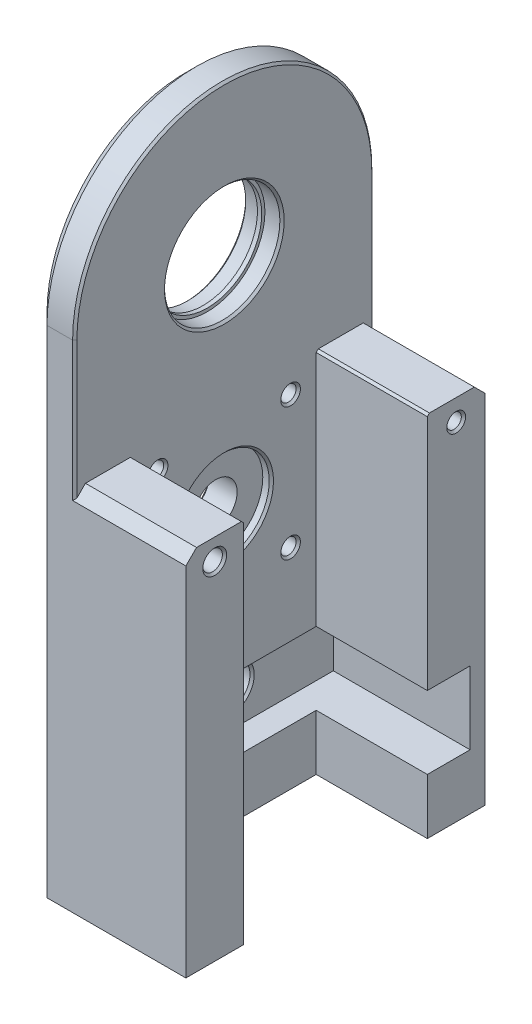
from build123d import *

# Parameters (mm, degrees)
SKETCH2_W                                           = 70
SKETCH2_H                                           = 86
BOSS_EXTRUDE1_DEPTH                                 = 35
SKETCH9_W                                           = 43
SKETCH9_H                                           = 43
SKETCH9_R                                           = 11
SKETCH9_R_2                                         = 5
SKETCH9_W_2                                         = 10
SKETCH9_H_2                                         = 17
CUT_EXTRUDE1_DEPTH                                  = 26
SKETCH2_5_R                                         = 12.75
BOSS_EXTRUDE2_DEPTH                                 = 9
SKETCH9_3_R                                         = 11
SKETCH9_3_R_2                                       = 5
CUT_EXTRUDE2_DEPTH                                  = 28
SKETCH9_4_R                                         = 5
CUT_EXTRUDE3_DEPTH                                  = 171.076453397
SKETCH20_R                                          = 13.5
CUT_EXTRUDE4_DEPTH                                  = 4
CBORE_FOR_M3_HEX_SOCKET_HEAD_CAP_SCREW1_D           = 3.6
CBORE_FOR_M3_HEX_SOCKET_HEAD_CAP_SCREW1_CBORE_D     = 6.5
CBORE_FOR_M3_HEX_SOCKET_HEAD_CAP_SCREW1_CBORE_DEPTH = 3.4
F_4_6_4_6_DIAMETER_HOLE1_D                          = 4.6
F_4_6_4_6_DIAMETER_HOLE1_DEPTH                      = 6
F_4_6_4_6_DIAMETER_HOLE1_TIP                        = 1.381979424
CBORE_FOR_M3_HEX_SOCKET_HEAD_CAP_SCREW2_D           = 3.4
CBORE_FOR_M3_HEX_SOCKET_HEAD_CAP_SCREW2_CBORE_D     = 6.5
CBORE_FOR_M3_HEX_SOCKET_HEAD_CAP_SCREW2_CBORE_DEPTH = 21.4
F_4_6_4_6_DIAMETER_HOLE2_D                          = 4.6
F_4_6_4_6_DIAMETER_HOLE2_DEPTH                      = 6
F_4_6_4_6_DIAMETER_HOLE2_TIP                        = 1.381979424
F_4_6_4_6_DIAMETER_HOLE3_D                          = 4.6
F_4_6_4_6_DIAMETER_HOLE3_DEPTH                      = 5
F_4_6_4_6_DIAMETER_HOLE3_TIP                        = 1.381979424
CUT_EXTRUDE5_DEPTH                                  = 6
CUT_EXTRUDE6_REACH                                  = 170.455
F_2_5MM_CHAMFER1_SIZE                               = 2.5
F_0_5MM_CHAMFER2_SIZE                               = 0.5


with BuildPart() as part:
    # Sketch2 → Boss-Extrude1 (new body)
    with BuildSketch(Plane(origin=(0, 0, 0), x_dir=(0, 0, -1), z_dir=(1, 0, 0))):
        with Locations((35, 43)):
            Rectangle(SKETCH2_W, SKETCH2_H)
    extrude(amount=BOSS_EXTRUDE1_DEPTH)

    # Sketch9 → Cut-Extrude1 (cut)
    # profile 1 of 5: a face of its own
    with BuildSketch(Plane(origin=(35, 0, 0), x_dir=(0, 0, -1), z_dir=(1, 0, 0))):
        with Locations((35, 64.5)):
            Rectangle(SKETCH9_W, SKETCH9_H)
        with Locations((35, 64.5)):
            Circle(SKETCH9_R, mode=Mode.SUBTRACT)
    # profile 2 of 5: a face of its own
    with BuildSketch(Plane(origin=(35, 0, 0), x_dir=(0, 0, -1), z_dir=(1, 0, 0))):
        with Locations((35, 64.5)):
            Circle(SKETCH9_R)
        with Locations((35, 64.5)):
            Circle(SKETCH9_R_2, mode=Mode.SUBTRACT)
    # profile 3 of 5: a face of its own
    with BuildSketch(Plane(origin=(35, 0, 0), x_dir=(0, 0, -1), z_dir=(1, 0, 0))):
        with Locations((35, 64.5)):
            Circle(SKETCH9_R_2)
    # profile 4 of 5: a face of its own
    with BuildSketch(Plane(origin=(35, 0, 0), x_dir=(0, 0, -1), z_dir=(1, 0, 0))):
        Polygon((56.5, 43), (13.5, 43), (13.5, 0), (56.5, 0), (56.5, 13), (56.5, 30), align=None)
    # profile 5 of 5: a face of its own
    with BuildSketch(Plane(origin=(35, 0, 0), x_dir=(0, 0, -1), z_dir=(1, 0, 0))):
        with Locations((61.5, 21.5)):
            Rectangle(SKETCH9_W_2, SKETCH9_H_2)
    extrude(amount=-CUT_EXTRUDE1_DEPTH, mode=Mode.SUBTRACT)

    # Sketch2<5> → Boss-Extrude2 (add)
    with BuildSketch(Plane(origin=(0, 0, 0), x_dir=(0, 0, -1), z_dir=(1, 0, 0))):
        with BuildLine():
            Line((0, 116), (0, 86))
            Line((0, 86), (70, 86))
            Line((70, 86), (70, 116))
            ThreePointArc((70, 116), (35, 151), (0, 116))
        make_face()
        with Locations((35, 116)):
            Circle(SKETCH2_5_R, mode=Mode.SUBTRACT)
    extrude(amount=BOSS_EXTRUDE2_DEPTH)

    # Sketch9<3> → Cut-Extrude2 (cut)
    # profile 1 of 2: a face of its own
    with BuildSketch(Plane(origin=(35, 0, 0), x_dir=(0, 0, -1), z_dir=(1, 0, 0))):
        with Locations((35, 64.5)):
            Circle(SKETCH9_3_R)
        with Locations((35, 64.5)):
            Circle(SKETCH9_3_R_2, mode=Mode.SUBTRACT)
    # profile 2 of 2: a face of its own
    with BuildSketch(Plane(origin=(35, 0, 0), x_dir=(0, 0, -1), z_dir=(1, 0, 0))):
        with Locations((35, 64.5)):
            Circle(SKETCH9_3_R_2)
    extrude(amount=-CUT_EXTRUDE2_DEPTH, mode=Mode.SUBTRACT)

    # Sketch9<4> → Cut-Extrude3 (cut, through all)
    with BuildSketch(Plane(origin=(35, 0, 0), x_dir=(0, 0, -1), z_dir=(1, 0, 0))):
        with Locations((35, 64.5)):
            Circle(SKETCH9_4_R)
    extrude(amount=-CUT_EXTRUDE3_DEPTH, mode=Mode.SUBTRACT)

    # Sketch20 → Cut-Extrude4 (cut)
    with BuildSketch(Plane(origin=(9, 0, 0), x_dir=(0, 0, -1), z_dir=(1, 0, 0))):
        with Locations((35, 116)):
            Circle(SKETCH20_R)
    cut_extrude4 = extrude(amount=-CUT_EXTRUDE4_DEPTH, mode=Mode.SUBTRACT)

    # Mirror1: Cut-Extrude4 across plane
    add(cut_extrude4.mirror(Plane(origin=(4.5, 0, 0), x_dir=(0, 0, 1), z_dir=(1, 0, 0))), mode=Mode.SUBTRACT)

    # CBORE for M3 Hex Socket Head Cap Screw1 (through all)
    with Locations(Plane.ZY):
        with Locations((-19.5, 49), (-35, 64.5), (-19.5, 80), (-50.5, 49), (-50.5, 80)):
            CounterBoreHole(CBORE_FOR_M3_HEX_SOCKET_HEAD_CAP_SCREW1_D / 2, CBORE_FOR_M3_HEX_SOCKET_HEAD_CAP_SCREW1_CBORE_D / 2, CBORE_FOR_M3_HEX_SOCKET_HEAD_CAP_SCREW1_CBORE_DEPTH)

    # Ø4.6 (4.6) Diameter Hole1
    with Locations(Plane(origin=(0, 0, 0), x_dir=(-1, 0, 0), z_dir=(0, -1, 0))):
        with Locations((-4.5, 35), (-35, 35), (-4.5, 63.5), (-4.5, 6.5)):
            Hole(F_4_6_4_6_DIAMETER_HOLE1_D / 2, depth=F_4_6_4_6_DIAMETER_HOLE1_DEPTH)
            with Locations((0, 0, -(F_4_6_4_6_DIAMETER_HOLE1_DEPTH + F_4_6_4_6_DIAMETER_HOLE1_TIP / 2))):  # 118° drill point
                Cone(0, F_4_6_4_6_DIAMETER_HOLE1_D / 2, F_4_6_4_6_DIAMETER_HOLE1_TIP, mode=Mode.SUBTRACT)

    # CBORE for M3 Hex Socket Head Cap Screw2 (through all)
    with Locations(Plane.ZY):
        with Locations((-63.25, 81)):
            CounterBoreHole(CBORE_FOR_M3_HEX_SOCKET_HEAD_CAP_SCREW2_D / 2, CBORE_FOR_M3_HEX_SOCKET_HEAD_CAP_SCREW2_CBORE_D / 2, CBORE_FOR_M3_HEX_SOCKET_HEAD_CAP_SCREW2_CBORE_DEPTH)

    # Ø4.6 (4.6) Diameter Hole2
    with Locations(Plane(origin=(35, 0, 0), x_dir=(0, 0, -1), z_dir=(1, 0, 0))):
        with Locations((6.75, 81)):
            Hole(F_4_6_4_6_DIAMETER_HOLE2_D / 2, depth=F_4_6_4_6_DIAMETER_HOLE2_DEPTH)
            with Locations((0, 0, -(F_4_6_4_6_DIAMETER_HOLE2_DEPTH + F_4_6_4_6_DIAMETER_HOLE2_TIP / 2))):  # 118° drill point
                Cone(0, F_4_6_4_6_DIAMETER_HOLE2_D / 2, F_4_6_4_6_DIAMETER_HOLE2_TIP, mode=Mode.SUBTRACT)

    # Ø4.6 (4.6) Diameter Hole3
    with Locations(Plane.ZY):
        with Locations((-60, 89.5), (-10, 89.5)):
            Hole(F_4_6_4_6_DIAMETER_HOLE3_D / 2, depth=F_4_6_4_6_DIAMETER_HOLE3_DEPTH)
            with Locations((0, 0, -(F_4_6_4_6_DIAMETER_HOLE3_DEPTH + F_4_6_4_6_DIAMETER_HOLE3_TIP / 2))):  # 118° drill point
                Cone(0, F_4_6_4_6_DIAMETER_HOLE3_D / 2, F_4_6_4_6_DIAMETER_HOLE3_TIP, mode=Mode.SUBTRACT)

    # Sketch23 → Cut-Extrude5 (cut)
    # profile 1 of 2: a face of its own
    with BuildSketch(Plane(origin=(9, 0, 0), x_dir=(0, 0, -1), z_dir=(1, 0, 0))):
        Polygon((56.5, 13), (66.5, 13), (66.5, 30), (56.5, 30), (22.5, 30), (22.5, 21.49999992), (22.5, 13), align=None)
        with BuildLine():
            ThreePointArc((27.5, 16.5), (23.964466122, 17.964466066), (22.5, 21.49999992))
            ThreePointArc((22.5, 21.49999992), (23.964466066, 25.035533878), (27.5, 26.5))
            Line((27.5, 26.5), (42.5, 26.5))
            ThreePointArc((42.5, 26.5), (47.5, 21.5), (42.5, 16.5))
            Line((42.5, 16.5), (27.5, 16.5))
        make_face(mode=Mode.SUBTRACT)
    # profile 2 of 2: a face of its own
    with BuildSketch(Plane(origin=(9, 0, 0), x_dir=(0, 0, -1), z_dir=(1, 0, 0))):
        with BuildLine():
            Line((27.5, 16.5), (42.5, 16.5))
            ThreePointArc((42.5, 16.5), (47.5, 21.5), (42.5, 26.5))
            Line((42.5, 26.5), (27.5, 26.5))
            ThreePointArc((27.5, 26.5), (22.5, 21.5), (27.5, 16.5))
        make_face()
    extrude(amount=-CUT_EXTRUDE5_DEPTH, mode=Mode.SUBTRACT)

    # Sketch23<3> → Cut-Extrude6 (cut, up to next)
    with BuildSketch(Plane(origin=(9, 0, 0), x_dir=(0, 0, -1), z_dir=(1, 0, 0)), mode=Mode.PRIVATE) as cut_extrude6_sk1:
        with BuildLine():
            Line((27.5, 16.5), (42.5, 16.5))
            ThreePointArc((42.5, 16.5), (47.5, 21.5), (42.5, 26.5))
            Line((42.5, 26.5), (27.5, 26.5))
            ThreePointArc((27.5, 26.5), (22.5, 21.5), (27.5, 16.5))
        make_face()
    cut_extrude6_tool1 = extrude(cut_extrude6_sk1.sketch, amount=-CUT_EXTRUDE6_REACH, mode=Mode.PRIVATE) & part.part
    add(cut_extrude6_tool1.solids().sort_by_distance((9, 21.5, -35))[0], mode=Mode.SUBTRACT)

    # 2,5mm Chamfer1
    f_2_5mm_chamfer1_edges = [part.edges().sort_by_distance(p)[0] for p in [
        (0, 151, -35),
        (0, 58, 0),
        (0, 58, -70),
        (22, 86, 0),
        (22, 86, -70),
    ]]
    chamfer(f_2_5mm_chamfer1_edges, length=F_2_5MM_CHAMFER1_SIZE)

    # 0,5mm Chamfer2
    # the kernel refuses this chamfer: 0.5 mm, written as the material it takes off along each edge
    with BuildSketch(Plane(origin=(9, 80, -50.5), x_dir=(0, 0, -1), z_dir=(0, -1, 0))) as f_0_5mm_chamfer2_piece_1:
        Polygon((1.8 + F_0_5MM_CHAMFER2_SIZE, 0), (1.8, -F_0_5MM_CHAMFER2_SIZE), (1.8, 0), align=None)
    revolve(axis=Axis((9, 80, -50.5), (1, 0, 0)), mode=Mode.SUBTRACT)
    with BuildSketch(Plane(origin=(0, 80, -50.5), x_dir=(0, 0, 1), z_dir=(0, -1, 0))) as f_0_5mm_chamfer2_piece_2:
        Polygon((3.25, -F_0_5MM_CHAMFER2_SIZE), (3.25 + F_0_5MM_CHAMFER2_SIZE, 0), (3.25, 0), align=None)
    revolve(axis=Axis((0, 80, -50.5), (-1, 0, 0)), mode=Mode.SUBTRACT)
    with BuildSketch(Plane(origin=(9, 49, -50.5), x_dir=(0, 0, -1), z_dir=(0, -1, 0))) as f_0_5mm_chamfer2_piece_3:
        Polygon((1.8 + F_0_5MM_CHAMFER2_SIZE, 0), (1.8, -F_0_5MM_CHAMFER2_SIZE), (1.8, 0), align=None)
    revolve(axis=Axis((9, 49, -50.5), (1, 0, 0)), mode=Mode.SUBTRACT)
    with BuildSketch(Plane(origin=(0, 49, -50.5), x_dir=(0, 0, 1), z_dir=(0, -1, 0))) as f_0_5mm_chamfer2_piece_4:
        Polygon((3.25, -F_0_5MM_CHAMFER2_SIZE), (3.25 + F_0_5MM_CHAMFER2_SIZE, 0), (3.25, 0), align=None)
    revolve(axis=Axis((0, 49, -50.5), (-1, 0, 0)), mode=Mode.SUBTRACT)
    with BuildSketch(Plane(origin=(3.4, 49, -50.5), x_dir=(0, 0, -1), z_dir=(0, -1, 0))) as f_0_5mm_chamfer2_piece_5:
        Polygon((1.8, F_0_5MM_CHAMFER2_SIZE), (1.8 + F_0_5MM_CHAMFER2_SIZE, 0), (1.8, 0), align=None)
    revolve(axis=Axis((3.4, 49, -50.5), (1, 0, 0)), mode=Mode.SUBTRACT)
    with BuildSketch(Plane(origin=(9, 80, -19.5), x_dir=(0, 0, -1), z_dir=(0, -1, 0))) as f_0_5mm_chamfer2_piece_6:
        Polygon((1.8 + F_0_5MM_CHAMFER2_SIZE, 0), (1.8, -F_0_5MM_CHAMFER2_SIZE), (1.8, 0), align=None)
    revolve(axis=Axis((9, 80, -19.5), (1, 0, 0)), mode=Mode.SUBTRACT)
    with BuildSketch(Plane(origin=(0, 80, -19.5), x_dir=(0, 0, 1), z_dir=(0, -1, 0))) as f_0_5mm_chamfer2_piece_7:
        Polygon((3.25, -F_0_5MM_CHAMFER2_SIZE), (3.25 + F_0_5MM_CHAMFER2_SIZE, 0), (3.25, 0), align=None)
    revolve(axis=Axis((0, 80, -19.5), (-1, 0, 0)), mode=Mode.SUBTRACT)
    with BuildSketch(Plane(origin=(4.5, 0, -35), x_dir=(1, 0, 0), z_dir=(0, 0, 1))) as f_0_5mm_chamfer2_piece_8:
        Polygon((2.3 + F_0_5MM_CHAMFER2_SIZE, 0), (2.3, F_0_5MM_CHAMFER2_SIZE), (2.3, 0), align=None)
    revolve(axis=Axis((4.5, 0, -35), (0, 1, 0)), mode=Mode.SUBTRACT)
    with BuildSketch(Plane(origin=(4.5, 0, -6.5), x_dir=(1, 0, 0), z_dir=(0, 0, 1))) as f_0_5mm_chamfer2_piece_9:
        Polygon((2.3 + F_0_5MM_CHAMFER2_SIZE, 0), (2.3, F_0_5MM_CHAMFER2_SIZE), (2.3, 0), align=None)
    revolve(axis=Axis((4.5, 0, -6.5), (0, 1, 0)), mode=Mode.SUBTRACT)
    with BuildSketch(Plane(origin=(4.5, 0, -63.5), x_dir=(1, 0, 0), z_dir=(0, 0, 1))) as f_0_5mm_chamfer2_piece_10:
        Polygon((2.3 + F_0_5MM_CHAMFER2_SIZE, 0), (2.3, F_0_5MM_CHAMFER2_SIZE), (2.3, 0), align=None)
    revolve(axis=Axis((4.5, 0, -63.5), (0, 1, 0)), mode=Mode.SUBTRACT)
    with BuildSketch(Plane(origin=(0, 81, -63.25), x_dir=(0, 0, 1), z_dir=(0, -1, 0))) as f_0_5mm_chamfer2_piece_11:
        Polygon((3.25, -F_0_5MM_CHAMFER2_SIZE), (3.25 + F_0_5MM_CHAMFER2_SIZE, 0), (3.25, 0), align=None)
    revolve(axis=Axis((0, 81, -63.25), (-1, 0, 0)), mode=Mode.SUBTRACT)
    with BuildSketch(Plane(origin=(35, 81, -63.25), x_dir=(0, 0, -1), z_dir=(0, -1, 0))) as f_0_5mm_chamfer2_piece_12:
        Polygon((1.7 + F_0_5MM_CHAMFER2_SIZE, 0), (1.7, -F_0_5MM_CHAMFER2_SIZE), (1.7, 0), align=None)
    revolve(axis=Axis((35, 81, -63.25), (1, 0, 0)), mode=Mode.SUBTRACT)
    with BuildSketch(Plane(origin=(35, 81, -6.75), x_dir=(0, 0, 1), z_dir=(0, -1, 0))) as f_0_5mm_chamfer2_piece_13:
        Polygon((2.3 + F_0_5MM_CHAMFER2_SIZE, 0), (2.3, F_0_5MM_CHAMFER2_SIZE), (2.3, 0), align=None)
    revolve(axis=Axis((35, 81, -6.75), (-1, 0, 0)), mode=Mode.SUBTRACT)
    with BuildSketch(Plane(origin=(0, 89.5, -60), x_dir=(0, 0, -1), z_dir=(0, -1, 0))) as f_0_5mm_chamfer2_piece_14:
        Polygon((2.3 + F_0_5MM_CHAMFER2_SIZE, 0), (2.3, F_0_5MM_CHAMFER2_SIZE), (2.3, 0), align=None)
    revolve(axis=Axis((0, 89.5, -60), (1, 0, 0)), mode=Mode.SUBTRACT)
    with BuildSketch(Plane(origin=(0, 89.5, -10), x_dir=(0, 0, -1), z_dir=(0, -1, 0))) as f_0_5mm_chamfer2_piece_15:
        Polygon((2.3 + F_0_5MM_CHAMFER2_SIZE, 0), (2.3, F_0_5MM_CHAMFER2_SIZE), (2.3, 0), align=None)
    revolve(axis=Axis((0, 89.5, -10), (1, 0, 0)), mode=Mode.SUBTRACT)
    with BuildSketch(Plane(origin=(3, 16.5, -42.5), x_dir=(0.02749587661058651, -0.9996219169112968, 0), z_dir=(0, 0, 1)), Plane(origin=(0, 26.5, -27.5), x_dir=(0.9996219169112968, -0.02749587661058908, 0), z_dir=(0, 0, -1)), Plane(origin=(3, 26.5, -27.5), x_dir=(0.027495876610586414, 0.9996219169112968, 0), z_dir=(0, 0, -1)), Plane(origin=(0, 16.5, -42.5), x_dir=(0.9996219169112968, 0.02749587661058908, 0), z_dir=(0, 0, 1))) as f_0_5mm_chamfer2_piece_16:
        Polygon((F_0_5MM_CHAMFER2_SIZE * 0.999621916911, -F_0_5MM_CHAMFER2_SIZE * 0.0274958766106), (-F_0_5MM_CHAMFER2_SIZE * 0.0274958766106, -F_0_5MM_CHAMFER2_SIZE * 0.999621916911), (0, 0), align=None)
    extrude(amount=15, mode=Mode.SUBTRACT)
    with BuildSketch(Plane(origin=(3, 21.5, -27.5), x_dir=(0, -1, 0), z_dir=(0, 0, -1))) as f_0_5mm_chamfer2_piece_17_section:
        Polygon((5 + F_0_5MM_CHAMFER2_SIZE, 0), (5, F_0_5MM_CHAMFER2_SIZE), (5, 0), align=None)
    f_0_5mm_chamfer2_piece_17 = revolve(axis=Axis((3, 21.5, -27.5), (-1, 0, 0)), revolution_arc=90, mode=Mode.PRIVATE)
    f_0_5mm_chamfer2_piece_17 = split(f_0_5mm_chamfer2_piece_17, bisect_by=Plane(origin=(2.857900217, 16.356388303, -22.5), z_dir=(0, 0, -1)), keep=Keep.TOP, mode=Mode.PRIVATE)
    add(f_0_5mm_chamfer2_piece_17, mode=Mode.SUBTRACT)
    with BuildSketch(Plane(origin=(3, 21.5, -27.5), x_dir=(0, 0, 1), z_dir=(0, -1, 0))) as f_0_5mm_chamfer2_piece_18_section:
        Polygon((5 + F_0_5MM_CHAMFER2_SIZE, 0), (5, F_0_5MM_CHAMFER2_SIZE), (5, 0), align=None)
    f_0_5mm_chamfer2_piece_18 = revolve(axis=Axis((3, 21.5, -27.5), (-1, 0, 0)), revolution_arc=90, mode=Mode.PRIVATE)
    f_0_5mm_chamfer2_piece_18 = split(f_0_5mm_chamfer2_piece_18, bisect_by=Plane(origin=(2.756305159, 25.207852181, -22.5), z_dir=(0, 0, -1)), keep=Keep.TOP, mode=Mode.PRIVATE)
    add(f_0_5mm_chamfer2_piece_18, mode=Mode.SUBTRACT)
    with BuildSketch(Plane(origin=(3, 21.5, -42.5), x_dir=(0, -1, 0), z_dir=(0, 0, 1))) as f_0_5mm_chamfer2_piece_19:
        Polygon((5 + F_0_5MM_CHAMFER2_SIZE, 0), (5, -F_0_5MM_CHAMFER2_SIZE), (5, 0), align=None)
    revolve(axis=Axis((3, 21.5, -42.5), (1, 0, 0)), revolution_arc=180, mode=Mode.SUBTRACT)
    with BuildSketch(Plane(origin=(0, 21.5, -42.5), x_dir=(0, -1, 0), z_dir=(0, 0, 1))) as f_0_5mm_chamfer2_piece_20:
        Polygon((5, F_0_5MM_CHAMFER2_SIZE), (5 + F_0_5MM_CHAMFER2_SIZE, 0), (5, 0), align=None)
    revolve(axis=Axis((0, 21.5, -42.5), (1, 0, 0)), revolution_arc=180, mode=Mode.SUBTRACT)
    with BuildSketch(Plane(origin=(0, 21.5, -27.5), x_dir=(0, 1, 0), z_dir=(0, 0, -1))) as f_0_5mm_chamfer2_piece_21:
        Polygon((5, F_0_5MM_CHAMFER2_SIZE), (5 + F_0_5MM_CHAMFER2_SIZE, 0), (5, 0), align=None)
    revolve(axis=Axis((0, 21.5, -27.5), (1, 0, 0)), revolution_arc=180, mode=Mode.SUBTRACT)
    with BuildSketch(Plane(origin=(36.285841494, 86, -13.5), x_dir=(0, 0.0274958766105822, 0.999621916911297), z_dir=(-1, 0, 0))) as f_0_5mm_chamfer2_piece_22:
        Polygon((F_0_5MM_CHAMFER2_SIZE * 0.999621916911, -F_0_5MM_CHAMFER2_SIZE * 0.0274958766106), (-F_0_5MM_CHAMFER2_SIZE * 0.0274958766106, -F_0_5MM_CHAMFER2_SIZE * 0.999621916911), (0, 0), align=None)
    extrude(amount=27.285841494, mode=Mode.SUBTRACT)
    with BuildSketch(Plane(origin=(36.285841494, 86, -56.5), x_dir=(0, 0.02749587661058229, -0.9996219169112968), z_dir=(-1, 0, 0))) as f_0_5mm_chamfer2_piece_23:
        Polygon((F_0_5MM_CHAMFER2_SIZE * 0.999621916911, F_0_5MM_CHAMFER2_SIZE * 0.0274958766106), (-F_0_5MM_CHAMFER2_SIZE * 0.0274958766106, F_0_5MM_CHAMFER2_SIZE * 0.999621916911), (0, 0), align=None)
    extrude(amount=27.285841494, mode=Mode.SUBTRACT)
    with BuildSketch(Plane(origin=(9, 82.214158506, 0), x_dir=(0.02749587661058563, 0, -0.9996219169112968), z_dir=(0, 1, 0))) as f_0_5mm_chamfer2_piece_24_section:
        Polygon((F_0_5MM_CHAMFER2_SIZE * 0.999621916911, F_0_5MM_CHAMFER2_SIZE * 0.0274958766106), (-F_0_5MM_CHAMFER2_SIZE * 0.0274958766106, F_0_5MM_CHAMFER2_SIZE * 0.999621916911), (0, 0), align=None)
    f_0_5mm_chamfer2_piece_24 = extrude(amount=33.785841494, mode=Mode.PRIVATE)
    f_0_5mm_chamfer2_piece_24 = split(f_0_5mm_chamfer2_piece_24, bisect_by=Plane(origin=(8.830530304, 90.974038618, -7.474038618), z_dir=(0, 0.7071067811865476, 0.7071067811865476)), keep=Keep.TOP, mode=Mode.PRIVATE)
    add(f_0_5mm_chamfer2_piece_24, mode=Mode.SUBTRACT)
    with BuildSketch(Plane(origin=(9, 116, -70), x_dir=(0.02749587661058574, 0, 0.9996219169112968), z_dir=(0, -1, 0))) as f_0_5mm_chamfer2_piece_25_section:
        Polygon((F_0_5MM_CHAMFER2_SIZE * 0.999621916911, F_0_5MM_CHAMFER2_SIZE * 0.0274958766106), (-F_0_5MM_CHAMFER2_SIZE * 0.0274958766106, F_0_5MM_CHAMFER2_SIZE * 0.999621916911), (0, 0), align=None)
    f_0_5mm_chamfer2_piece_25 = extrude(amount=33.785841494, mode=Mode.PRIVATE)
    f_0_5mm_chamfer2_piece_25 = split(f_0_5mm_chamfer2_piece_25, bisect_by=Plane(origin=(8.857094112, 98.934594611, -54.565405389), z_dir=(0, 0.7071067811865476, -0.7071067811865476)), keep=Keep.TOP, mode=Mode.PRIVATE)
    add(f_0_5mm_chamfer2_piece_25, mode=Mode.SUBTRACT)
    with BuildSketch(Plane(origin=(9, 116, -35), x_dir=(0, 0, -1), z_dir=(0, -1, 0))) as f_0_5mm_chamfer2_piece_26:
        Polygon((35 - F_0_5MM_CHAMFER2_SIZE, 0), (35, -F_0_5MM_CHAMFER2_SIZE), (35, 0), align=None)
    revolve(axis=Axis((9, 116, -35), (1, 0, 0)), revolution_arc=180, mode=Mode.SUBTRACT)
    with BuildSketch(Plane(origin=(9, 64.5, -35), x_dir=(0, 0, -1), z_dir=(0, -1, 0))) as f_0_5mm_chamfer2_piece_27:
        Polygon((11 + F_0_5MM_CHAMFER2_SIZE, 0), (11, -F_0_5MM_CHAMFER2_SIZE), (11, 0), align=None)
    revolve(axis=Axis((9, 64.5, -35), (1, 0, 0)), mode=Mode.SUBTRACT)
    with BuildSketch(Plane(origin=(0, 64.5, -35), x_dir=(0, 0, -1), z_dir=(0, -1, 0))) as f_0_5mm_chamfer2_piece_28:
        Polygon((5, F_0_5MM_CHAMFER2_SIZE), (5 + F_0_5MM_CHAMFER2_SIZE, 0), (5, 0), align=None)
    revolve(axis=Axis((0, 64.5, -35), (1, 0, 0)), mode=Mode.SUBTRACT)
    with BuildSketch(Plane(origin=(9, 116, -35), x_dir=(0, 0, -1), z_dir=(0, -1, 0))) as f_0_5mm_chamfer2_piece_29:
        Polygon((13.5 + F_0_5MM_CHAMFER2_SIZE, 0), (13.5, -F_0_5MM_CHAMFER2_SIZE), (13.5, 0), align=None)
    revolve(axis=Axis((9, 116, -35), (1, 0, 0)), mode=Mode.SUBTRACT)
    with BuildSketch(Plane(origin=(0, 116, -35), x_dir=(0, 0, -1), z_dir=(0, -1, 0))) as f_0_5mm_chamfer2_piece_30:
        Polygon((13.5, F_0_5MM_CHAMFER2_SIZE), (13.5 + F_0_5MM_CHAMFER2_SIZE, 0), (13.5, 0), align=None)
    revolve(axis=Axis((0, 116, -35), (1, 0, 0)), mode=Mode.SUBTRACT)
    with BuildSketch(Plane(origin=(9, 49, -19.5), x_dir=(0, 0, -1), z_dir=(0, -1, 0))) as f_0_5mm_chamfer2_piece_31:
        Polygon((1.8 + F_0_5MM_CHAMFER2_SIZE, 0), (1.8, -F_0_5MM_CHAMFER2_SIZE), (1.8, 0), align=None)
    revolve(axis=Axis((9, 49, -19.5), (1, 0, 0)), mode=Mode.SUBTRACT)
    with BuildSketch(Plane(origin=(0, 49, -19.5), x_dir=(0, 0, 1), z_dir=(0, -1, 0))) as f_0_5mm_chamfer2_piece_32:
        Polygon((3.25, -F_0_5MM_CHAMFER2_SIZE), (3.25 + F_0_5MM_CHAMFER2_SIZE, 0), (3.25, 0), align=None)
    revolve(axis=Axis((0, 49, -19.5), (-1, 0, 0)), mode=Mode.SUBTRACT)


solid = part.part
